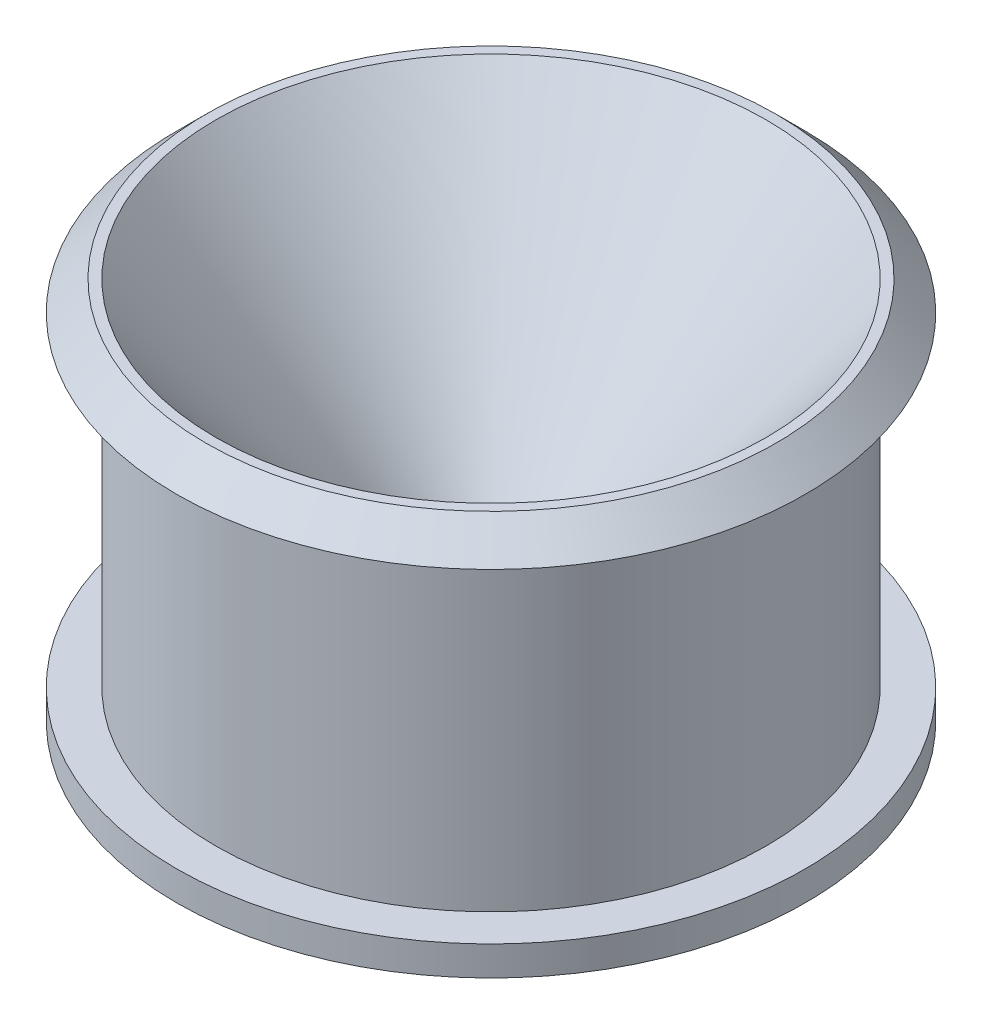
from build123d import *

# Parameters (mm, degrees)
SKETCH2_W     = 4
SKETCH2_H     = 3
CHAMFER1_SIZE = 3


with BuildPart() as part:
    # Sketch2 → Revolve1 (revolve)
    with BuildSketch(Plane.XY, mode=Mode.PRIVATE) as revolve1_sk:
        Polygon((-28, 0), (-3, 0), (-3, 8), (-7, 8), (-7, 12.96), (-28, 39), (-28, 36), (-28, 3), align=None)
        with Locations((-30, 1.5)):
            Rectangle(SKETCH2_W, SKETCH2_H)
        with Locations((-30, 37.5)):
            Rectangle(SKETCH2_W, SKETCH2_H)
    revolve(revolve1_sk.sketch.rotate(Axis((0, 0, 0), (0, 1, 0)), 270), axis=Axis((0, 0, 0), (0, 1, 0)))

    # Chamfer1
    chamfer1_edges = [part.edges().sort_by_distance(p)[0] for p in [
        (0, 39, 32),
    ]]
    chamfer(chamfer1_edges, length=CHAMFER1_SIZE - 0.0001)  # a hair under: the kernel refuses the full size


solid = part.part
